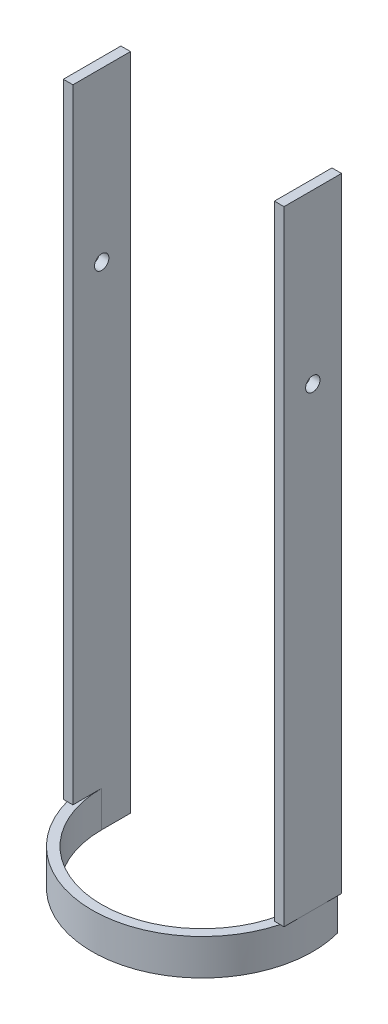
from build123d import *

# Parameters (mm, degrees)
EXTRUDE_1_DEPTH     = 30
SKETCH_4_W          = 4
SKETCH_4_H          = 24
EXTRUDE_3_DEPTH     = 260
SKETCH_7_W          = 149.597155604
SKETCH_7_H          = 115.941502163
CUT_EXTRUDE_3_DEPTH = 300.299181422
SKETCH_9_R          = 3
CUT_EXTRUDE_5_DEPTH = 308.701153719
SKETCH_10_R         = 50
SKETCH_10_R_2       = 46
CUT_EXTRUDE_6_DEPTH = 15


with BuildPart() as part:
    # 草图1 → 凸台-拉伸1 (new body)
    with BuildSketch(Plane(origin=(0, 0, 0), x_dir=(1, 0, 0), z_dir=(0, 1, 0))):
        with BuildLine():
            Line((-46, 0), (-46, 12))
            Line((-46, 12), (-42, 12))
            Line((-42, 12), (-42, 0))
            ThreePointArc((-42, 0), (0, -42), (42, 0))
            Line((42, 0), (42, 12))
            Line((42, 12), (46, 12))
            Line((46, 12), (46, 0))
            ThreePointArc((46, 0), (0, -46), (-46, 0))
        make_face()
    extrude(amount=EXTRUDE_1_DEPTH)

    # 草图4 → 凸台-拉伸3 (add)
    with BuildSketch(Plane(origin=(0, 30, 0), x_dir=(1, 0, 0), z_dir=(0, 1, 0))):
        with Locations((44, 0)):
            Rectangle(SKETCH_4_W, SKETCH_4_H)
        with Locations((-44, 0)):
            Rectangle(SKETCH_4_W, SKETCH_4_H)
    extrude(amount=EXTRUDE_3_DEPTH)

    # 草图7 → 切除-拉伸3 (cut, through all)
    with BuildSketch(Plane(origin=(0, 0, -12), x_dir=(-1, 0, 0), z_dir=(0, 0, -1))):
        with Locations((8.175952602, -42.970751082)):
            Rectangle(SKETCH_7_W, SKETCH_7_H)
    extrude(amount=-CUT_EXTRUDE_3_DEPTH, mode=Mode.SUBTRACT)

    # 草图9 → 切除-拉伸5 (cut, through all)
    with BuildSketch(Plane(origin=(46, 0, 0), x_dir=(0, 0, -1), z_dir=(1, 0, 0))):
        with Locations((0, 220)):
            Circle(SKETCH_9_R)
    extrude(amount=-CUT_EXTRUDE_5_DEPTH, mode=Mode.SUBTRACT)

    # 草图10 → 切除-拉伸6 (cut)
    with BuildSketch(Plane.XZ.offset(-15)):
        Circle(SKETCH_10_R)
        Circle(SKETCH_10_R_2, mode=Mode.SUBTRACT)
    extrude(amount=-CUT_EXTRUDE_6_DEPTH, mode=Mode.SUBTRACT)


solid = part.part
